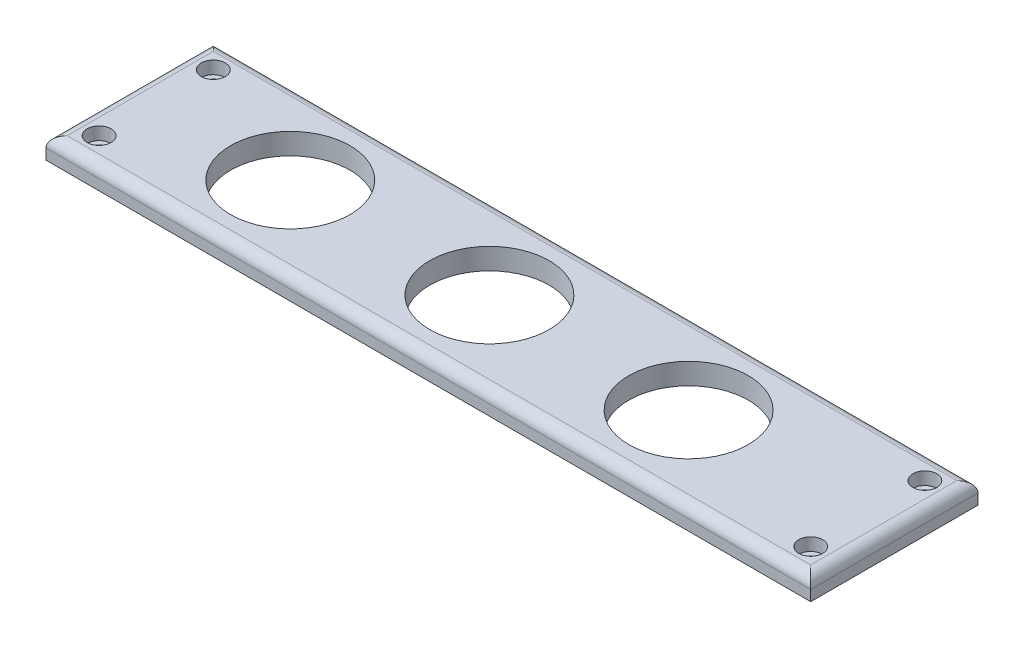
from build123d import *

# Parameters (mm, degrees)
SKETCH_1_W          = 288
SKETCH_1_H          = 63
EXTRUDE_1_DEPTH     = 8
SKETCH_2_R          = 22.5
CUT_EXTRUDE_1_DEPTH = 8
SKETCH_2_3_R        = 22.5
CUT_EXTRUDE_2_DEPTH = 8
SKETCH_2_4_R        = 22.5
CUT_EXTRUDE_3_DEPTH = 8
FILLET_4_R          = 4
SKETCH_3_R          = 2.5
CUT_EXTRUDE_4_DEPTH = 295.918632846
SKETCH_3_3_R        = 4.5
CUT_EXTRUDE_5_DEPTH = 4.8
SKETCH_3_4_R        = 2.5
CUT_EXTRUDE_6_DEPTH = 295.918632846


with BuildPart() as part:
    # Эскиз1 → Бобышка-Вытянуть1 (new body)
    with BuildSketch(Plane(origin=(0, 0, 0), x_dir=(1, 0, 0), z_dir=(0, 1, 0))):
        with Locations((144, 31.5)):
            Rectangle(SKETCH_1_W, SKETCH_1_H)
    extrude(amount=EXTRUDE_1_DEPTH)

    # Эскиз2 → Вырез-Вытянуть1 (cut)
    with BuildSketch(Plane(origin=(0, 8, 0), x_dir=(1, 0, 0), z_dir=(0, 1, 0))):
        with Locations((60.5, 31.5)):
            Circle(SKETCH_2_R)
    extrude(amount=-CUT_EXTRUDE_1_DEPTH, mode=Mode.SUBTRACT)

    # Эскиз2<3> → Вырез-Вытянуть2 (cut)
    with BuildSketch(Plane(origin=(0, 8, 0), x_dir=(1, 0, 0), z_dir=(0, 1, 0))):
        with Locations((135.5, 31.5)):
            Circle(SKETCH_2_3_R)
    extrude(amount=-CUT_EXTRUDE_2_DEPTH, mode=Mode.SUBTRACT)

    # Эскиз2<4> → Вырез-Вытянуть3 (cut)
    with BuildSketch(Plane(origin=(0, 8, 0), x_dir=(1, 0, 0), z_dir=(0, 1, 0))):
        with Locations((210.5, 31.5)):
            Circle(SKETCH_2_4_R)
    extrude(amount=-CUT_EXTRUDE_3_DEPTH, mode=Mode.SUBTRACT)

    # Скругление4
    fillet_4_edges = [part.edges().sort_by_distance(p)[0] for p in [
        (144, 8, -63),
        (0, 8, -31.5),
        (144, 8, 0),
        (288, 8, -31.5),
    ]]
    fillet(fillet_4_edges, radius=FILLET_4_R)

    # Эскиз3 → Вырез-Вытянуть4 (cut, through all)
    with BuildSketch(Plane(origin=(0, 8, 0), x_dir=(1, 0, 0), z_dir=(0, 1, 0))):
        with Locations((10, 53)):
            Circle(SKETCH_3_R)
        with Locations((10, 10)):
            Circle(SKETCH_3_R)
    extrude(amount=-CUT_EXTRUDE_4_DEPTH, mode=Mode.SUBTRACT)

    # Эскиз3<3> → Вырез-Вытянуть5 (cut)
    with BuildSketch(Plane(origin=(0, 8, 0), x_dir=(1, 0, 0), z_dir=(0, 1, 0))):
        with Locations((10, 53)):
            Circle(SKETCH_3_3_R)
        with Locations((10, 10)):
            Circle(SKETCH_3_3_R)
        with Locations((278, 10)):
            Circle(SKETCH_3_3_R)
        with Locations((278, 53)):
            Circle(SKETCH_3_3_R)
    extrude(amount=-CUT_EXTRUDE_5_DEPTH, mode=Mode.SUBTRACT)

    # Эскиз3<4> → Вырез-Вытянуть6 (cut, through all)
    with BuildSketch(Plane(origin=(0, 8, 0), x_dir=(1, 0, 0), z_dir=(0, 1, 0))):
        with Locations((278, 10)):
            Circle(SKETCH_3_4_R)
        with Locations((278, 53)):
            Circle(SKETCH_3_4_R)
    extrude(amount=-CUT_EXTRUDE_6_DEPTH, mode=Mode.SUBTRACT)


solid = part.part
